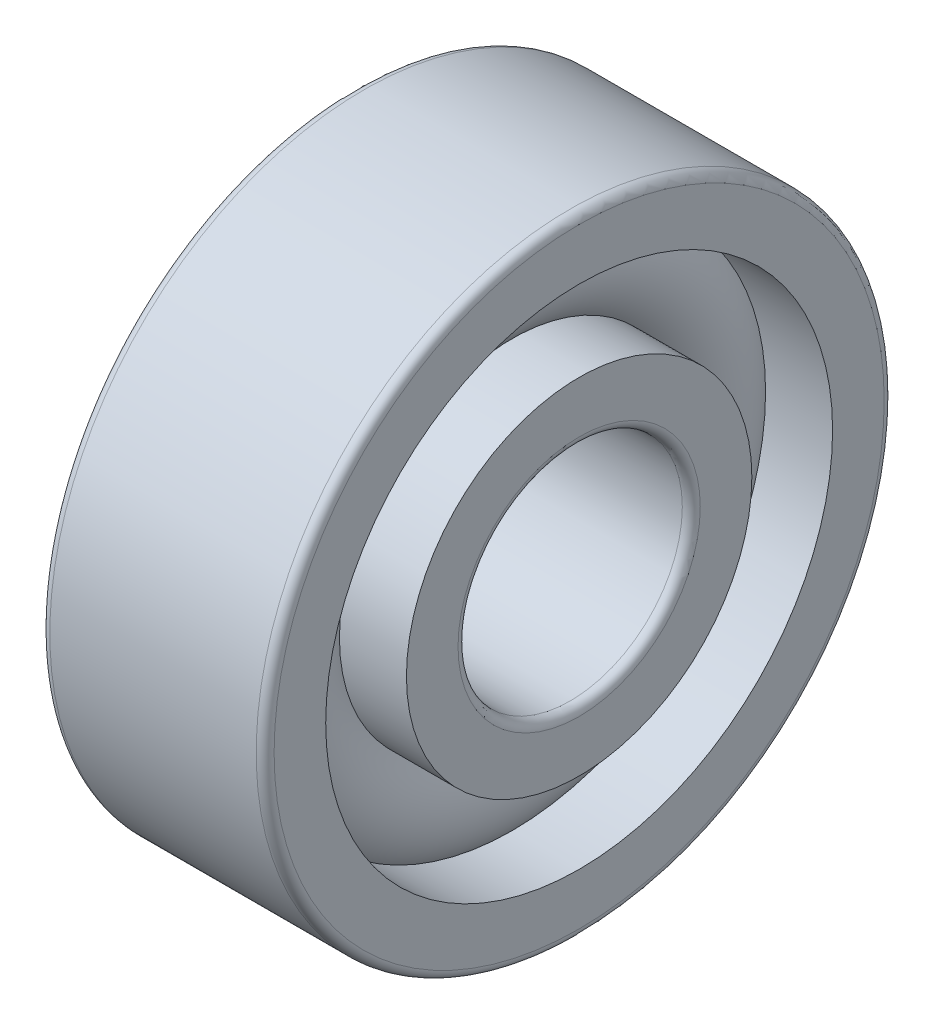
from build123d import *

# Parameters (mm, degrees)
CAGSPISKE_W     = 0.27
CAGSPISKE_H     = 0.45
CAGESPINE_ANGLE = 0.001
BALSIMSKE_R     = 1.35


with BuildPart() as part:
    # CagSpiSke → CageSpine (revolve)
    with BuildSketch(Plane.XY):
        with Locations((0, 4.75)):
            Rectangle(CAGSPISKE_W, CAGSPISKE_H)
    revolve(axis=Axis((-20.6375, 0, 0), (-1, 0, 0)), revolution_arc=CAGESPINE_ANGLE)

    # BalSimSke → BallsSimplified (revolve)
    with BuildSketch(Plane.XY):
        with Locations((0, 4.75)):
            Circle(BALSIMSKE_R)
    revolve(axis=Axis((-10, 0, 0), (1, 0, 0)))

    # InnRacSke → InnerRace (revolve)
    with BuildSketch(Plane.XY):
        with BuildLine():
            Line((-0.972432517, 3.85), (-2.5, 3.85))
            Line((-2.5, 3.85), (-2.5, 2.7))
            ThreePointArc((-2.5, 2.7), (-2.441421356, 2.558578644), (-2.3, 2.5))
            Line((-2.3, 2.5), (2.3, 2.5))
            ThreePointArc((2.3, 2.5), (2.441421356, 2.558578644), (2.5, 2.7))
            Line((2.5, 2.7), (2.5, 3.85))
            Line((2.5, 3.85), (0.972432517, 3.85))
            ThreePointArc((0.972432517, 3.85), (0, 3.425), (-0.972432517, 3.85))
        make_face()
    revolve(axis=Axis((-20.6375, 0, 0), (1, 0, 0)))

    # OutRacSke → OuterRace (revolve)
    with BuildSketch(Plane.XY):
        with BuildLine():
            Line((-0.972432517, 5.65), (-2.5, 5.65))
            Line((-2.5, 5.65), (-2.5, 6.8))
            ThreePointArc((-2.5, 6.8), (-2.441421356, 6.941421356), (-2.3, 7))
            Line((-2.3, 7), (2.3, 7))
            ThreePointArc((2.3, 7), (2.441421356, 6.941421356), (2.5, 6.8))
            Line((2.5, 6.8), (2.5, 5.65))
            Line((2.5, 5.65), (0.972432517, 5.65))
            ThreePointArc((0.972432517, 5.65), (0, 6.075), (-0.972432517, 5.65))
        make_face()
    revolve(axis=Axis((-20.6375, 0, 0), (1, 0, 0)))


solid = part.part
